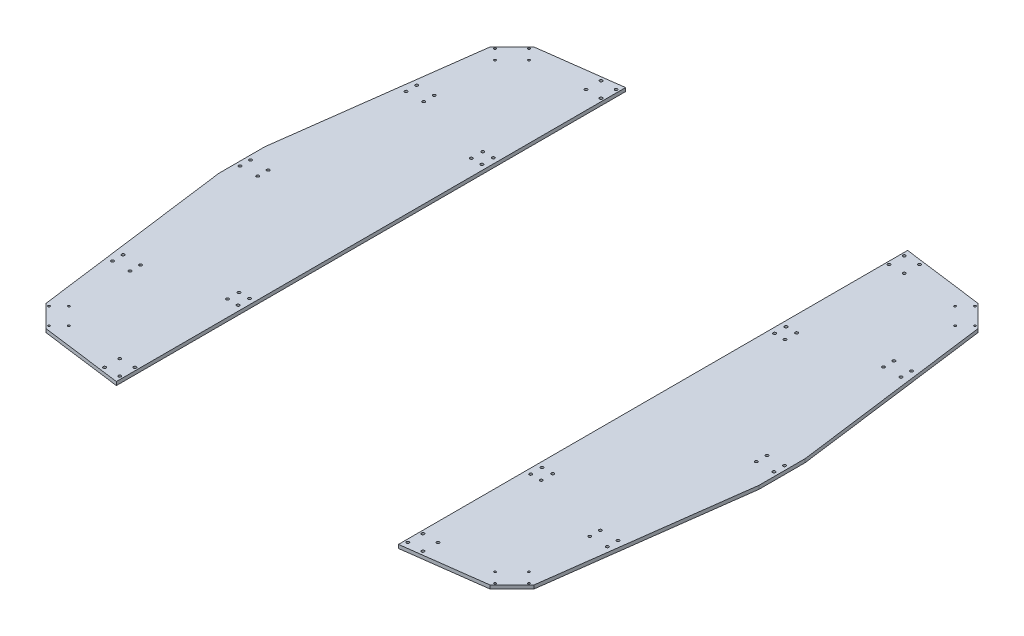
from build123d import *

# Parameters (mm, degrees)
SKETCH_1_R               = 1.5
SKETCH_1_R_2             = 2.000000001
SKETCH_1_R_3             = 2
SKETCH_1_R_4             = 2.000000003
SKETCH_1_R_5             = 1.999999999
SKETCH_1_R_6             = 250
EXTRUDE_2_DEPTH          = 5
CUT_EXTRUDE_1_DEPTH      = 542.772616539
CUT_EXTRUDE_1_DEPTH_BACK = 122
CUT_EXTRUDE_2_DEPTH      = 527.431195247
CUT_EXTRUDE_2_DEPTH_BACK = 39
SKETCH_3_R               = 2
CUT_EXTRUDE_3_DEPTH      = 20
CUT_EXTRUDE_3_DEPTH_BACK = 527.431195247
SKETCH_4_R               = 2
EXTRUDE_3_DEPTH          = 5


with BuildPart() as part:
    # 草图1 → 凸台-拉伸2 (new body)
    with BuildSketch(Plane(origin=(0, 0, 0), x_dir=(1, 0, 0), z_dir=(0, 1, 0))):
        Polygon((-32.720120418, 383.074776011), (-314.922171201, 345.922171201), (-345.922171201, 314.922171201), (-383.074776011, 32.720120418), (-383.074776011, -32.720120418), (-345.922171201, -314.922171201), (-314.922171201, -345.922171201), (-32.720120418, -383.074776011), (32.720120418, -383.074776011), (314.922171201, -345.922171201), (345.922171201, -314.922171201), (383.074776011, -32.720120418), (383.074776011, 32.720120418), (345.922171201, 314.922171201), (314.922171201, 345.922171201), (32.720120418, 383.074776011), (0, 383.074776011), align=None)
        with Locations((-316.280035574, -340.321666135)):
            Circle(SKETCH_1_R, mode=Mode.SUBTRACT)
        with Locations((-340.321666135, -316.280035574)):
            Circle(SKETCH_1_R, mode=Mode.SUBTRACT)
        with Locations((-302.137899951, -326.179530511)):
            Circle(SKETCH_1_R, mode=Mode.SUBTRACT)
        with Locations((-326.179530511, -302.137899951)):
            Circle(SKETCH_1_R, mode=Mode.SUBTRACT)
        with Locations((-350.918362047, -215.681953428)):
            Circle(SKETCH_1_R_2, mode=Mode.SUBTRACT)
        with Locations((-350.918362047, -200.681953428)):
            Circle(SKETCH_1_R_2, mode=Mode.SUBTRACT)
        with Locations((-325.918362047, -215.681953428)):
            Circle(SKETCH_1_R_2, mode=Mode.SUBTRACT)
        with Locations((-325.918362047, -200.681953428)):
            Circle(SKETCH_1_R_2, mode=Mode.SUBTRACT)
        with Locations((-222.5, -181.030079822)):
            Circle(SKETCH_1_R_3, mode=Mode.SUBTRACT)
        with Locations((-207.5, -181.030079822)):
            Circle(SKETCH_1_R_3, mode=Mode.SUBTRACT)
        with Locations((-222.5, -164.825516547)):
            Circle(SKETCH_1_R_3, mode=Mode.SUBTRACT)
        with Locations((-207.5, -164.825516547)):
            Circle(SKETCH_1_R_3, mode=Mode.SUBTRACT)
        with Locations((-377.074776011, -8.757539326)):
            Circle(SKETCH_1_R_3, mode=Mode.SUBTRACT)
        with Locations((-352.074776011, -8.532227141)):
            Circle(SKETCH_1_R_3, mode=Mode.SUBTRACT)
        with Locations((316.280035574, -340.321666135)):
            Circle(SKETCH_1_R, mode=Mode.SUBTRACT)
        with Locations((302.137899951, -326.179530511)):
            Circle(SKETCH_1_R, mode=Mode.SUBTRACT)
        with Locations((326.179530511, -302.137899951)):
            Circle(SKETCH_1_R, mode=Mode.SUBTRACT)
        with Locations((340.321666135, -316.280035574)):
            Circle(SKETCH_1_R, mode=Mode.SUBTRACT)
        with Locations((325.918362047, -215.681953435)):
            Circle(SKETCH_1_R_4, mode=Mode.SUBTRACT)
        with Locations((325.918362047, -200.681953435)):
            Circle(SKETCH_1_R_4, mode=Mode.SUBTRACT)
        with Locations((350.918362047, -215.681953435)):
            Circle(SKETCH_1_R_4, mode=Mode.SUBTRACT)
        with Locations((350.918362047, -200.681953435)):
            Circle(SKETCH_1_R_4, mode=Mode.SUBTRACT)
        with Locations((207.5, -181.030079822)):
            Circle(SKETCH_1_R_3, mode=Mode.SUBTRACT)
        with Locations((222.5, -181.030079822)):
            Circle(SKETCH_1_R_3, mode=Mode.SUBTRACT)
        with Locations((207.5, -164.825516547)):
            Circle(SKETCH_1_R_3, mode=Mode.SUBTRACT)
        with Locations((222.5, -164.825516547)):
            Circle(SKETCH_1_R_3, mode=Mode.SUBTRACT)
        with Locations((352.074776011, -5.594774246)):
            Circle(SKETCH_1_R_3, mode=Mode.SUBTRACT)
        with Locations((377.074776011, -5.594774246)):
            Circle(SKETCH_1_R_3, mode=Mode.SUBTRACT)
        with Locations((-377.074776011, 6.242460674)):
            Circle(SKETCH_1_R_3, mode=Mode.SUBTRACT)
        with Locations((-352.074776011, 6.242460674)):
            Circle(SKETCH_1_R_3, mode=Mode.SUBTRACT)
        with Locations((-222.5, 164.825516547)):
            Circle(SKETCH_1_R_3, mode=Mode.SUBTRACT)
        with Locations((-207.5, 164.825516547)):
            Circle(SKETCH_1_R_3, mode=Mode.SUBTRACT)
        with Locations((-222.5, 181.030079822)):
            Circle(SKETCH_1_R_3, mode=Mode.SUBTRACT)
        with Locations((-207.5, 181.030079822)):
            Circle(SKETCH_1_R_3, mode=Mode.SUBTRACT)
        with Locations((-350.918362047, 200.681953428)):
            Circle(SKETCH_1_R_5, mode=Mode.SUBTRACT)
        with Locations((-350.918362047, 215.681953428)):
            Circle(SKETCH_1_R_5, mode=Mode.SUBTRACT)
        with Locations((-325.918362047, 200.681953428)):
            Circle(SKETCH_1_R_5, mode=Mode.SUBTRACT)
        with Locations((-325.918362047, 215.681953428)):
            Circle(SKETCH_1_R_5, mode=Mode.SUBTRACT)
        with Locations((-340.321666135, 316.280035574)):
            Circle(SKETCH_1_R, mode=Mode.SUBTRACT)
        with Locations((-326.179530511, 302.137899951)):
            Circle(SKETCH_1_R, mode=Mode.SUBTRACT)
        with Locations((-302.13789995, 326.179530511)):
            Circle(SKETCH_1_R, mode=Mode.SUBTRACT)
        with Locations((-316.280035574, 340.321666135)):
            Circle(SKETCH_1_R, mode=Mode.SUBTRACT)
        Circle(SKETCH_1_R_6, mode=Mode.SUBTRACT)
        with Locations((352.074776011, 9.405225754)):
            Circle(SKETCH_1_R_3, mode=Mode.SUBTRACT)
        with Locations((377.074776011, 9.405225754)):
            Circle(SKETCH_1_R_3, mode=Mode.SUBTRACT)
        with Locations((207.5, 164.825516547)):
            Circle(SKETCH_1_R_3, mode=Mode.SUBTRACT)
        with Locations((222.5, 164.825516547)):
            Circle(SKETCH_1_R_3, mode=Mode.SUBTRACT)
        with Locations((207.5, 181.030079822)):
            Circle(SKETCH_1_R_3, mode=Mode.SUBTRACT)
        with Locations((222.5, 181.030079822)):
            Circle(SKETCH_1_R_3, mode=Mode.SUBTRACT)
        with Locations((325.918362047, 200.681953434)):
            Circle(SKETCH_1_R_5, mode=Mode.SUBTRACT)
        with Locations((325.918362047, 215.681953434)):
            Circle(SKETCH_1_R_5, mode=Mode.SUBTRACT)
        with Locations((350.918362047, 200.681953434)):
            Circle(SKETCH_1_R_5, mode=Mode.SUBTRACT)
        with Locations((350.918362047, 215.681953434)):
            Circle(SKETCH_1_R_5, mode=Mode.SUBTRACT)
        with Locations((326.179530511, 302.13789995)):
            Circle(SKETCH_1_R, mode=Mode.SUBTRACT)
        with Locations((302.137899951, 326.179530511)):
            Circle(SKETCH_1_R, mode=Mode.SUBTRACT)
        with Locations((340.321666135, 316.280035574)):
            Circle(SKETCH_1_R, mode=Mode.SUBTRACT)
        with Locations((316.280035574, 340.321666135)):
            Circle(SKETCH_1_R, mode=Mode.SUBTRACT)
    extrude(amount=EXTRUDE_2_DEPTH)

    # 草图2 → 切除-拉伸1 (cut, two sides: drawn at the far end of the back side and taken through both)
    with BuildSketch(Plane(origin=(0, 5, 0), x_dir=(1, 0, 0), z_dir=(0, 1, 0)).offset(-CUT_EXTRUDE_1_DEPTH_BACK)):
        Polygon((-200, 484.714921051), (-200, 361.051962068), (-200, -361.051962068), (-200, -418.819036359), (200, -418.819036359), (200, -361.051962068), (200, 361.051962068), (200, 484.714921051), align=None)
    extrude(amount=CUT_EXTRUDE_1_DEPTH + CUT_EXTRUDE_1_DEPTH_BACK, mode=Mode.SUBTRACT)


with BuildPart() as cut_extrude_1_piece_1:
    # of the separate pieces the step leaves, piece 1, a body of its own (cut_extrude_1_pieces)
    add(part.part.solids().sort_by_distance((-314.922171201, 0, 345.922171201))[0])

    # 草图3 → 切除-拉伸2 (cut, two sides: drawn at the far end of the back side and taken through both)
    with BuildSketch(Plane(origin=(0, 0, 0), x_dir=(-1, 0, 0), z_dir=(0, -1, 0)).offset(-CUT_EXTRUDE_2_DEPTH_BACK)):
        with Locations((225.752728605, -352.02249242)):
            Circle(SKETCH_3_R)
        with Locations((204.247271395, -352.02249242)):
            Circle(SKETCH_3_R)
        with Locations((225.752728605, -330.517035211)):
            Circle(SKETCH_3_R)
        with Locations((204.247271395, -330.517035211)):
            Circle(SKETCH_3_R)
    extrude(amount=CUT_EXTRUDE_2_DEPTH + CUT_EXTRUDE_2_DEPTH_BACK, mode=Mode.SUBTRACT)


with BuildPart() as cut_extrude_1_piece_2:
    # of the separate pieces the step leaves, piece 2, a body of its own (cut_extrude_1_pieces)
    add(part.part.solids().sort_by_distance((200, 0, 361.051962068))[0])


with BuildPart() as cut_extrude_3_tool:
    # 草图4 → 切除-拉伸3 (new, two sides: drawn at the far end of the back side and taken through both)
    with BuildSketch(Plane(origin=(0, 5, 0), x_dir=(1, 0, 0), z_dir=(0, 1, 0)).offset(-CUT_EXTRUDE_3_DEPTH_BACK)):
        with Locations((-204.247271395, 352.018568286)):
            Circle(SKETCH_4_R)
        with Locations((-225.752728605, 352.018568286)):
            Circle(SKETCH_4_R)
        with Locations((-225.752728605, 330.513111077)):
            Circle(SKETCH_4_R)
        with Locations((-204.247271395, 330.513111077)):
            Circle(SKETCH_4_R)
        with Locations((204.247271395, 330.513111077)):
            Circle(SKETCH_4_R)
        with Locations((225.752728605, 330.513111077)):
            Circle(SKETCH_4_R)
        with Locations((204.247271395, 352.018568286)):
            Circle(SKETCH_4_R)
        with Locations((225.752728605, 352.018568286)):
            Circle(SKETCH_4_R)
        with Locations((204.247271395, -352.02249242)):
            Circle(SKETCH_4_R)
        with Locations((225.752728605, -352.02249242)):
            Circle(SKETCH_4_R)
        with Locations((204.247271395, -330.517035211)):
            Circle(SKETCH_4_R)
        with Locations((225.752728605, -330.517035211)):
            Circle(SKETCH_4_R)
    extrude(amount=CUT_EXTRUDE_3_DEPTH + CUT_EXTRUDE_3_DEPTH_BACK)


with BuildPart() as cut_extrude_1_piece_1_1:
    add(cut_extrude_1_piece_1.part)

    # 切除-拉伸3: cut by cut_extrude_3_tool
    add(cut_extrude_3_tool.part, mode=Mode.SUBTRACT)



with BuildPart() as cut_extrude_1_piece_2_1:
    add(cut_extrude_1_piece_2.part)

    # 切除-拉伸3: cut by cut_extrude_3_tool
    add(cut_extrude_3_tool.part, mode=Mode.SUBTRACT)


with BuildPart() as cut_extrude_1_piece_1_2:
    add(cut_extrude_1_piece_1_1.part)

    add(cut_extrude_1_piece_2_1.part)  # 凸台-拉伸3 merges 切除-拉伸1 piece 2
    # 草图5 → 凸台-拉伸3 (add)
    with BuildSketch(Plane(origin=(0, 5, 0), x_dir=(1, 0, 0), z_dir=(0, 1, 0))):
        with BuildLine():
            Line((-200, -150), (-200, 150))
            ThreePointArc((-200, 150), (-250, 0), (-200, -150))
        make_face()
        with BuildLine():
            ThreePointArc((200, -150), (250, 0), (200, 150))
            Line((200, 150), (200, -150))
        make_face()
    extrude(amount=-EXTRUDE_3_DEPTH)


solid = cut_extrude_1_piece_1_2.part
